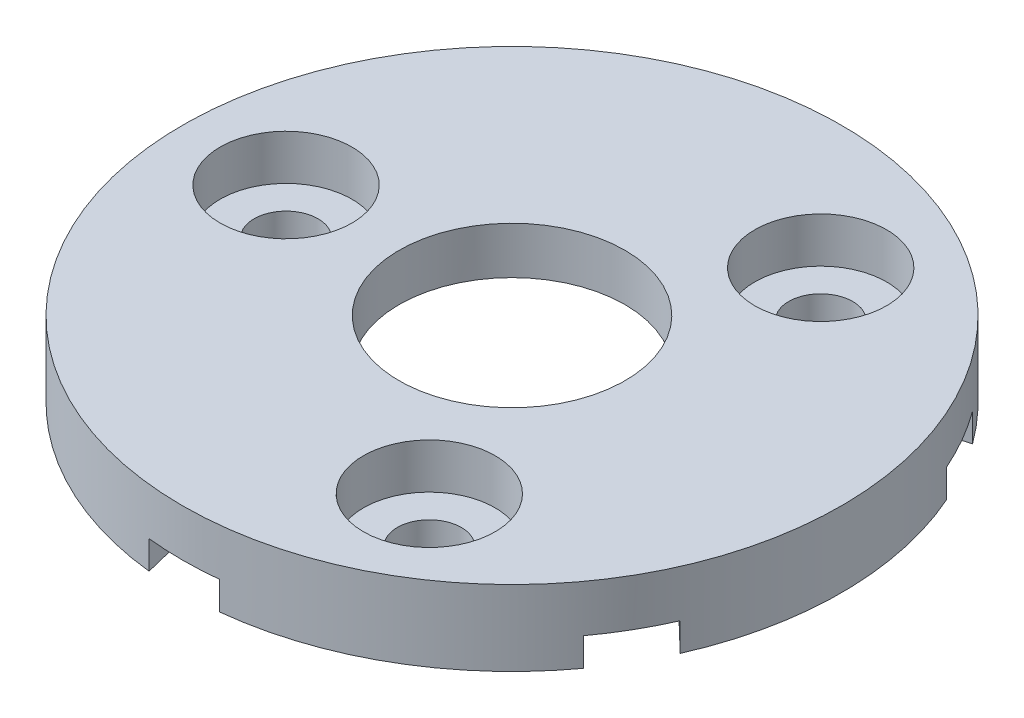
from build123d import *

# Parameters (mm, degrees)
SKETCH1_R                                = 17.5
BOSS_EXTRUDE1_DEPTH                      = 4
CBORE_FOR_M3_PAN_HEAD_SCREW1_D           = 3.4
CBORE_FOR_M3_PAN_HEAD_SCREW1_CBORE_D     = 7
CBORE_FOR_M3_PAN_HEAD_SCREW1_CBORE_DEPTH = 2.4
CIRPATTERN1_COUNT                        = 3
F_12_0_12_DIAMETER_HOLE1_D               = 12
CUT_EXTRUDE1_DEPTH                       = 1.5
CIRPATTERN2_COUNT                        = 6


with BuildPart() as part:
    # Sketch1 → Boss-Extrude1 (new body)
    with BuildSketch(Plane(origin=(0, 0, 0), x_dir=(1, 0, 0), z_dir=(0, 1, 0))):
        Circle(SKETCH1_R)
    extrude(amount=BOSS_EXTRUDE1_DEPTH)

    # CBORE for M3 Pan Head Screw1 (through all)
    with Locations(Plane(origin=(0, 4, 0), x_dir=(1, 0, 0), z_dir=(0, 1, 0))):
        with Locations((-12, 0)):
            cbore_for_m3_pan_head_screw1 = CounterBoreHole(CBORE_FOR_M3_PAN_HEAD_SCREW1_D / 2, CBORE_FOR_M3_PAN_HEAD_SCREW1_CBORE_D / 2, CBORE_FOR_M3_PAN_HEAD_SCREW1_CBORE_DEPTH)

    # CirPattern1: CBORE for M3 Pan Head Screw1 ×3 about axis
    cirpattern1_axis = Axis((0, 4, 0), (0, -1, 0))
    for i in range(1, CIRPATTERN1_COUNT):
        add(cbore_for_m3_pan_head_screw1.rotate(cirpattern1_axis, i * 360 / CIRPATTERN1_COUNT), mode=Mode.SUBTRACT)

    # Ø12.0 (12) Diameter Hole1 (through all)
    with Locations(Plane(origin=(0, 0, 0), x_dir=(-1, 0, 0), z_dir=(0, -1, 0))):
        with Locations((0, 0)):
            Hole(F_12_0_12_DIAMETER_HOLE1_D / 2)

    # Sketch7 → Cut-Extrude1 (cut)
    with BuildSketch(Plane.XZ):
        Polygon((0, 25), (-5.723634799, 1.800001303), (5.723634799, 1.800001303), align=None)
    cut_extrude1 = extrude(amount=-CUT_EXTRUDE1_DEPTH, mode=Mode.SUBTRACT)

    # CirPattern2: Cut-Extrude1 ×6 about axis
    cirpattern2_axis = Axis((0, 0, 0), (0, -1, 0))
    for i in range(1, CIRPATTERN2_COUNT):
        add(cut_extrude1.rotate(cirpattern2_axis, i * 360 / CIRPATTERN2_COUNT), mode=Mode.SUBTRACT)


solid = part.part
